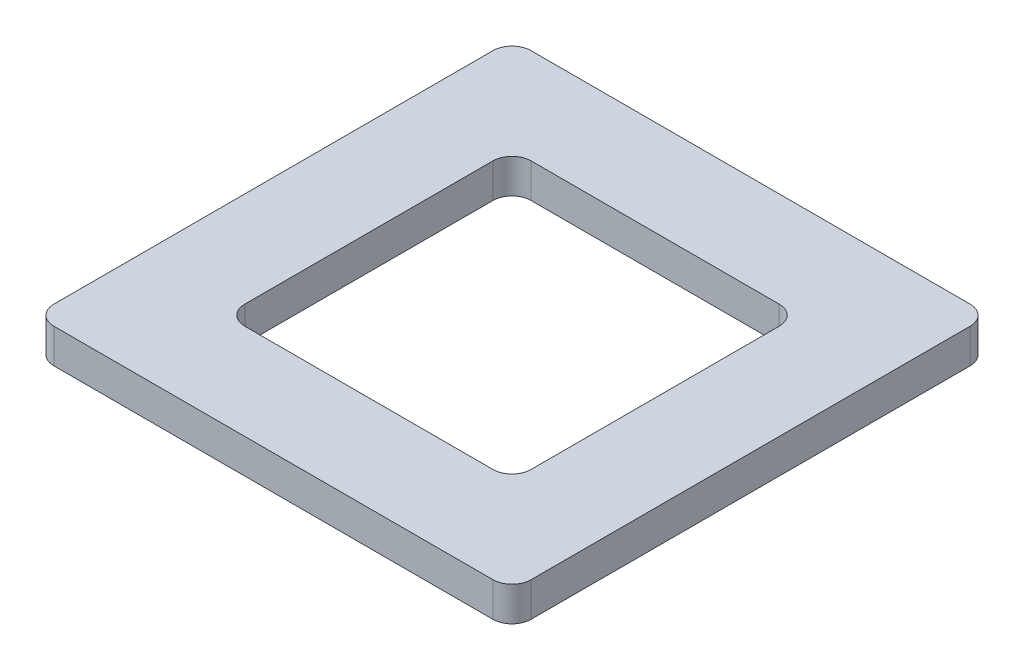
from build123d import *

# Parameters (mm, degrees)
SKETCH_1_W      = 250
SKETCH_1_H      = 250
SKETCH_1_W_2    = 150
SKETCH_1_H_2    = 150
EXTRUDE_1_DEPTH = 18
FILLET_1_R      = 10
FILLET_2_R      = 10


with BuildPart() as part:
    # 草图1 → 凸台-拉伸1 (new body)
    with BuildSketch(Plane(origin=(0, 0, 0), x_dir=(1, 0, 0), z_dir=(0, 1, 0))):
        Rectangle(SKETCH_1_W, SKETCH_1_H)
        Rectangle(SKETCH_1_W_2, SKETCH_1_H_2, mode=Mode.SUBTRACT)
    extrude(amount=EXTRUDE_1_DEPTH)

    # 圆角1
    fillet_1_edges = [part.edges().sort_by_distance(p)[0] for p in [
        (-125, 9, -125),
        (125, 9, -125),
        (125, 9, 125),
        (-125, 9, 125),
    ]]
    fillet(fillet_1_edges, radius=FILLET_1_R)

    # 圆角2
    fillet_2_edges = [part.edges().sort_by_distance(p)[0] for p in [
        (75, 9, 75),
        (-75, 9, 75),
        (75, 9, -75),
        (-75, 9, -75),
    ]]
    fillet(fillet_2_edges, radius=FILLET_2_R)


solid = part.part
